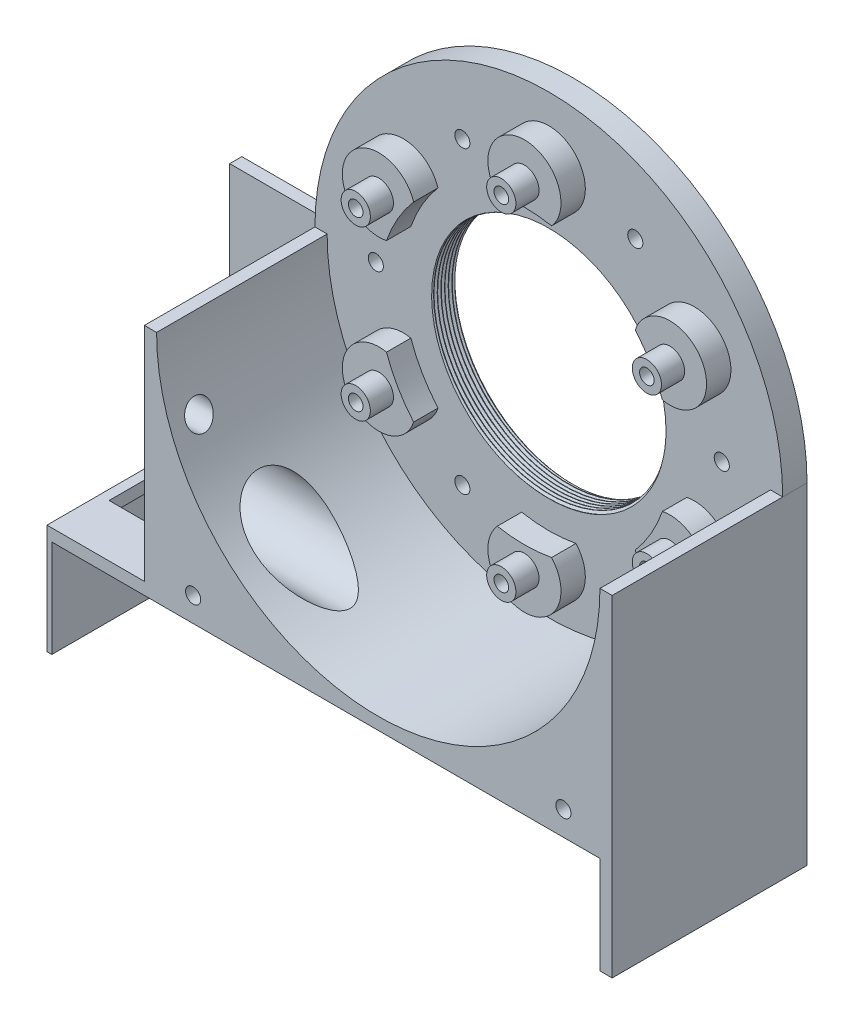
from build123d import *

# Parameters (mm, degrees)
ESQUISSE1_R                           = 48
ESQUISSE1_R_2                         = 23.8
BOSS_EXTRU_1_DEPTH                    = 40
ESQUISSE2_R                           = 45.5
ENL_V_MAT_EXTRU_1_DEPTH               = 35
ESQUISSE3_R                           = 7.5
BOSS_EXTRU_2_DEPTH                    = 5
ESQUISSE4_R                           = 30
ENL_V_MAT_EXTRU_2_DEPTH               = 29
ESQUISSE13_R                          = 3
ESQUISSE13_R_2                        = 1.5
BOSS_EXTRU_4_DEPTH                    = 4.75
CHANFREIN2_SIZE                       = 0.5
ENL_VEMENT_DE_MATI_RE_BALAYAGE1_PITCH = 0.75
ENL_V_MAT_EXTRU_6_DEPTH               = 35
ESQUISSE27_R                          = 7.675
ENL_V_MAT_EXTRU_7_DEPTH               = 79.790862536
ESQUISSE31_R                          = 1.55
ENL_V_MAT_EXTRU_8_DEPTH               = 77.374079544
BOSS_EXTRU_5_REACH                    = 116.543
BOSS_EXTRU_5_END_RADIUS               = 48
ESQUISSE33_W                          = 40
ESQUISSE33_H                          = 48
ESQUISSE33_R                          = 7.675
ESQUISSE33_R_2                        = 2.75
ESQUISSE35_R                          = 2.75
ENL_V_MAT_EXTRU_12_DEPTH              = 16
BOSS_EXTRU_6_DEPTH                    = 20
ESQUISSE37_W                          = 68
ESQUISSE37_H                          = 2.5
BOSS_EXTRU_7_DEPTH                    = 20
ESQUISSE39_W                          = 1
ESQUISSE39_H                          = 37.5
BOSS_EXTRU_8_DEPTH                    = 20
ESQUISSE40_W                          = 8
ESQUISSE40_H                          = 16
ENL_V_MAT_EXTRU_13_DEPTH              = 13
BOSS_EXTRU_10_REACH                   = 106.154
BOSS_EXTRU_11_DEPTH                   = 20
ESQUISSE46_R                          = 1.55
ENL_V_MAT_EXTRU_14_DEPTH              = 5


with BuildPart() as part:
    # Esquisse1 → Boss.-Extru.1 (new body)
    with BuildSketch(Plane.XY):
        Circle(ESQUISSE1_R)
        Circle(ESQUISSE1_R_2, mode=Mode.SUBTRACT)
    extrude(amount=BOSS_EXTRU_1_DEPTH)

    # Esquisse2 → Enlèv. mat.-Extru.1 (cut)
    with BuildSketch(Plane.XY.offset(40)):
        Circle(ESQUISSE2_R)
    extrude(amount=-ENL_V_MAT_EXTRU_1_DEPTH, mode=Mode.SUBTRACT)

    # Esquisse3 → Boss.-Extru.2 (add)
    with BuildSketch(Plane.XY.offset(5)):
        with Locations((0, 34.5)):
            Circle(ESQUISSE3_R)
        with Locations((29.877876431, 17.25)):
            Circle(ESQUISSE3_R)
        with Locations((29.877876431, -17.25)):
            Circle(ESQUISSE3_R)
        with Locations((0, -34.5)):
            Circle(ESQUISSE3_R)
        with Locations((-29.877876431, -17.25)):
            Circle(ESQUISSE3_R)
        with Locations((-29.877876431, 17.25)):
            Circle(ESQUISSE3_R)
    extrude(amount=BOSS_EXTRU_2_DEPTH)

    # Esquisse4 → Enlèv. mat.-Extru.2 (cut)
    with BuildSketch(Plane.XY.offset(5)):
        Circle(ESQUISSE4_R)
    extrude(amount=ENL_V_MAT_EXTRU_2_DEPTH, mode=Mode.SUBTRACT)

    # Esquisse13 → Boss.-Extru.4 (add)
    # profile 1 of 6: a face of its own
    with BuildSketch(Plane.XY.offset(10)):
        with Locations((0, 34.5)):
            Circle(ESQUISSE13_R)
        with Locations((0, 34.5)):
            Circle(ESQUISSE13_R_2, mode=Mode.SUBTRACT)
    # profile 2 of 6: a face of its own
    with BuildSketch(Plane.XY.offset(10)):
        with Locations((29.877876431, 17.25)):
            Circle(ESQUISSE13_R)
        with Locations((29.877876431, 17.25)):
            Circle(ESQUISSE13_R_2, mode=Mode.SUBTRACT)
    # profile 3 of 6: a face of its own
    with BuildSketch(Plane.XY.offset(10)):
        with Locations((29.877876431, -17.25)):
            Circle(ESQUISSE13_R)
        with Locations((29.877876431, -17.25)):
            Circle(ESQUISSE13_R_2, mode=Mode.SUBTRACT)
    # profile 4 of 6: a face of its own
    with BuildSketch(Plane.XY.offset(10)):
        with Locations((0, -34.5)):
            Circle(ESQUISSE13_R)
        with Locations((0, -34.5)):
            Circle(ESQUISSE13_R_2, mode=Mode.SUBTRACT)
    # profile 5 of 6: a face of its own
    with BuildSketch(Plane.XY.offset(10)):
        with Locations((-29.877876431, -17.25)):
            Circle(ESQUISSE13_R)
        with Locations((-29.877876431, -17.25)):
            Circle(ESQUISSE13_R_2, mode=Mode.SUBTRACT)
    # profile 6 of 6: a face of its own
    with BuildSketch(Plane.XY.offset(10)):
        with Locations((-29.877876431, 17.25)):
            Circle(ESQUISSE13_R)
        with Locations((-29.877876431, 17.25)):
            Circle(ESQUISSE13_R_2, mode=Mode.SUBTRACT)
    extrude(amount=BOSS_EXTRU_4_DEPTH)

    # Chanfrein2
    chanfrein2_edges = [part.edges().sort_by_distance(p)[0] for p in [
        (-23.8, 0, 0),
    ]]
    chamfer(chanfrein2_edges, length=CHANFREIN2_SIZE)

    # Enlèvement de matière-Balayage1: arcs per turn and ends read off the stored shape
    # Enlèvement de matière-Balayage1: the profile of Esquisse15 profile screwed along a left-hand helix through 10 turns, 8 arcs to a turn; built about Z, then put on its axis
    enl_vement_de_mati_re_balayage1_z = Axis((0, 0, 0), (0, 0, 1))
    enl_vement_de_mati_re_balayage1_corners = [(23.7997, 1.2461e-05, 0.644965711), (23.7997, 1.2461e-05, -0.017880699), (24.297964607, 1.2722e-05, 0.269792506), (24.297964607, 1.2722e-05, 0.357292506)]
    with BuildLine(mode=Mode.PRIVATE) as enl_vement_de_mati_re_balayage1_profile:
        Line(enl_vement_de_mati_re_balayage1_corners[0], enl_vement_de_mati_re_balayage1_corners[1])
        Line(enl_vement_de_mati_re_balayage1_corners[1], enl_vement_de_mati_re_balayage1_corners[2])
        Line(enl_vement_de_mati_re_balayage1_corners[2], enl_vement_de_mati_re_balayage1_corners[3])
        Line(enl_vement_de_mati_re_balayage1_corners[3], enl_vement_de_mati_re_balayage1_corners[0])
    enl_vement_de_mati_re_balayage1_cap = Face(enl_vement_de_mati_re_balayage1_profile.wire())
    enl_vement_de_mati_re_balayage1_turn_angles = [0, -22.5, -45, -67.5, -90, -112.5, -135, -157.5, -180, -202.5, -225, -247.5, -270, -292.5, -315, -337.5, -360]
    enl_vement_de_mati_re_balayage1_turn_weights = [1, 0.9238795325112867, 1, 0.9238795325112867, 1, 0.9238795325112867, 1, 0.9238795325112867, 1, 0.9238795325112867, 1, 0.9238795325112867, 1, 0.9238795325112867, 1, 0.9238795325112867, 1]
    enl_vement_de_mati_re_balayage1_turn_rails = [Edge.make_bspline([Vector(p[0], p[1], 0).rotate(enl_vement_de_mati_re_balayage1_z, enl_vement_de_mati_re_balayage1_turn_angles[k]) / enl_vement_de_mati_re_balayage1_turn_weights[k] + Vector(0, 0, p[2] + -ENL_VEMENT_DE_MATI_RE_BALAYAGE1_PITCH * enl_vement_de_mati_re_balayage1_turn_angles[k] / 360) for k in range(17)], [0, 0, 0, 1, 1, 2, 2, 3, 3, 4, 4, 5, 5, 6, 6, 7, 7, 8, 8, 8], 2, enl_vement_de_mati_re_balayage1_turn_weights) for p in enl_vement_de_mati_re_balayage1_corners]
    enl_vement_de_mati_re_balayage1_turn_sides = [Face.make_surface_from_curves(enl_vement_de_mati_re_balayage1_turn_rails[p[0]], enl_vement_de_mati_re_balayage1_turn_rails[p[1]]) for p in [(0, 1), (1, 2), (2, 3), (3, 0)]]
    enl_vement_de_mati_re_balayage1 = Plane(origin=(0, 0, 0), x_dir=(1, 0, 0), z_dir=(0, 0, 1)) * Solid(Shell([*[p.moved(Location((0, 0, ENL_VEMENT_DE_MATI_RE_BALAYAGE1_PITCH * i))) for i in range(10) for p in enl_vement_de_mati_re_balayage1_turn_sides], enl_vement_de_mati_re_balayage1_cap, enl_vement_de_mati_re_balayage1_cap.rotate(enl_vement_de_mati_re_balayage1_z, -3600).moved(Location((0, 0, -ENL_VEMENT_DE_MATI_RE_BALAYAGE1_PITCH * -3600 / 360)))]))
    add(enl_vement_de_mati_re_balayage1, mode=Mode.SUBTRACT)

    # Esquisse23 → Enlèv. mat.-Extru.6 (cut)
    with BuildSketch(Plane.XY.offset(40)):
        with BuildLine():
            Line((-43.941981962, 0), (-49.525958016, 0))
            ThreePointArc((-49.525958016, 0), (0, 49.525958016), (49.525958016, 0))
            Line((49.525958016, 0), (43.941981962, 0))
            ThreePointArc((43.941981962, 0), (0, 43.941981962), (-43.941981962, 0))
        make_face()
    extrude(amount=-ENL_V_MAT_EXTRU_6_DEPTH, mode=Mode.SUBTRACT)

    # Esquisse27 → Enlèv. mat.-Extru.7 (cut, through all)
    with BuildSketch(Plane(origin=(0, 0, 0), x_dir=(0, 0, -1), z_dir=(1, 0, 0))):
        with Locations((-27.5, -34)):
            Circle(ESQUISSE27_R)
    extrude(amount=-ENL_V_MAT_EXTRU_7_DEPTH, mode=Mode.SUBTRACT)

    # Esquisse31 → Enlèv. mat.-Extru.8 (cut, through all)
    with BuildSketch(Plane.XY.offset(5)):
        with Locations((-17.751728377, 30.742903891)):
            Circle(ESQUISSE31_R)
        with Locations((17.748271567, 30.744899681)):
            Circle(ESQUISSE31_R)
        with Locations((35.499999944, 0.00199579)):
            Circle(ESQUISSE31_R)
        with Locations((17.751728377, -30.742903891)):
            Circle(ESQUISSE31_R)
        with Locations((-17.748271567, -30.744899681)):
            Circle(ESQUISSE31_R)
        with Locations((-35.499999944, -0.00199579)):
            Circle(ESQUISSE31_R)
    extrude(amount=-ENL_V_MAT_EXTRU_8_DEPTH, mode=Mode.SUBTRACT)

    # Boss.-Extru.5: up to this cylinder (the profile starts outside it)
    boss_extru_5_end = Plane(origin=(0, 0, 19.125585), z_dir=(0, 0, -1)) * Cylinder(BOSS_EXTRU_5_END_RADIUS, 330.086, mode=Mode.PRIVATE)
    # Esquisse33 → Boss.-Extru.5 (add, up to the surface)
    with BuildSketch(Plane(origin=(-48, 0, 0), x_dir=(0, 0, -1), z_dir=(1, 0, 0)), mode=Mode.PRIVATE) as boss_extru_5_sk1:
        with Locations((-20, -24)):
            Rectangle(ESQUISSE33_W, ESQUISSE33_H)
        with Locations((-27.5, -34)):
            Circle(ESQUISSE33_R, mode=Mode.SUBTRACT)
        with Locations(Location((-34.217514421, -15.96877708, 0), (0, 0, 180))):
            Circle(ESQUISSE33_R_2, mode=Mode.SUBTRACT)
        with Locations(Location((-9.46877708, -40.717514421, 0), (0, 0, 180))):
            Circle(ESQUISSE33_R_2, mode=Mode.SUBTRACT)
    boss_extru_5_tool1 = extrude(boss_extru_5_sk1.sketch, amount=BOSS_EXTRU_5_REACH, mode=Mode.PRIVATE) - boss_extru_5_end
    add(boss_extru_5_tool1.solids().sort_by_distance((-48, -22.781015, 19.125585))[0])

    # Esquisse35 → Enlèv. mat.-Extru.12 (cut)
    with BuildSketch(Plane.ZY.offset(48)):
        with Locations((34.217514421, -15.96877708)):
            Circle(ESQUISSE35_R)
        with Locations((9.46877708, -40.717514421)):
            Circle(ESQUISSE35_R)
    extrude(amount=-ENL_V_MAT_EXTRU_12_DEPTH, mode=Mode.SUBTRACT)

    # Esquisse36 → Boss.-Extru.6 (add)
    with BuildSketch(Plane.ZY.offset(48)):
        Polygon((2.5, 0), (0, 0), (0, -48), (40, -48), (40, -45.5), (2.5, -45.5), align=None)
    extrude(amount=BOSS_EXTRU_6_DEPTH)

    # Esquisse37 → Boss.-Extru.7 (add)
    with BuildSketch(Plane.XZ.offset(48)):
        with Locations((-34, 1.25)):
            Rectangle(ESQUISSE37_W, ESQUISSE37_H)
    extrude(amount=BOSS_EXTRU_7_DEPTH)

    # Esquisse39 → Boss.-Extru.8 (add)
    with BuildSketch(Plane.XZ.offset(48)):
        with Locations((-67.5, 21.25)):
            Rectangle(ESQUISSE39_W, ESQUISSE39_H)
    extrude(amount=BOSS_EXTRU_8_DEPTH)

    # Esquisse40 → Enlèv. mat.-Extru.13 (cut)
    with BuildSketch(Plane.XZ.offset(48)):
        with Locations((-62, 21.25)):
            Rectangle(ESQUISSE40_W, ESQUISSE40_H)
    extrude(amount=-ENL_V_MAT_EXTRU_13_DEPTH, mode=Mode.SUBTRACT)

    # Boss.-Extru.10: up to this face of the body (flat: up to its plane)
    boss_extru_10_end = Plane(part.part.faces().sort_by_distance((32.781125497, 32.781125497, 0))[0])
    # Esquisse43 → Boss.-Extru.10 (add, up to the picked face)
    with BuildSketch(Plane.XY.offset(40), mode=Mode.PRIVATE) as boss_extru_10_sk1:
        with BuildLine():
            Line((0, -45.5), (0, -48))
            Line((0, -48), (48, -48))
            Line((48, -48), (48, 0))
            Line((48, 0), (45.5, 0))
            ThreePointArc((45.5, 0), (32.173358544, -32.173358544), (0, -45.5))
        make_face()
    boss_extru_10_tool1 = split(extrude(boss_extru_10_sk1.sketch, amount=-BOSS_EXTRU_10_REACH, mode=Mode.PRIVATE), bisect_by=boss_extru_10_end, keep=Keep.BOTH, mode=Mode.PRIVATE)
    add(boss_extru_10_tool1.solids().sort_by(Axis((35.245089, -35.245089, 40), (0, 0, -1)))[0])

    # Esquisse45 → Boss.-Extru.11 (add)
    with BuildSketch(Plane.XZ.offset(48)):
        Polygon((0, 0), (48, 0), (48, 2.5), (48, 40), (45.5, 40), (45.5, 2.5), (0, 2.5), align=None)
    extrude(amount=BOSS_EXTRU_11_DEPTH)

    # Esquisse46 → Enlèv. mat.-Extru.14 (cut)
    with BuildSketch(Plane.XY.offset(40)):
        with Locations((-38, -43)):
            Circle(ESQUISSE46_R)
        with Locations((38, -43)):
            Circle(ESQUISSE46_R)
    extrude(amount=-ENL_V_MAT_EXTRU_14_DEPTH, mode=Mode.SUBTRACT)


solid = part.part
